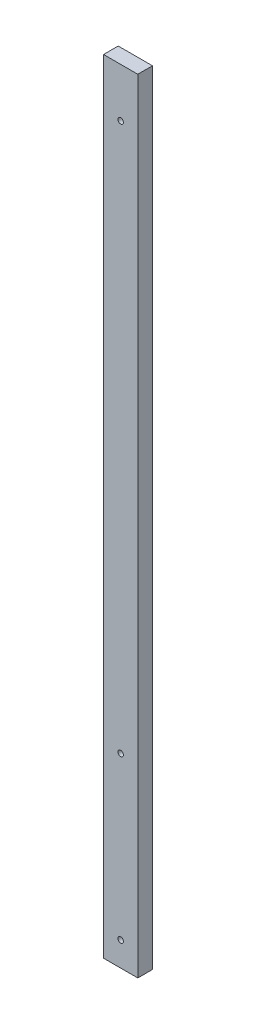
from build123d import *

# Parameters (mm, degrees)
SKETCH1_W               = 88.9
SKETCH1_H               = 38.1
BOSS_EXTRUDE1_DEPTH     = 2032
CUT_EXTRUDE1_DEPTH      = 2033.843184434
CUT_EXTRUDE1_DEPTH_BACK = 2033.843184434
SKETCH2_R               = 7.14375


with BuildPart() as part:
    # Sketch1 → Boss-Extrude1 (new body)
    with BuildSketch(Plane(origin=(0, 0, 0), x_dir=(1, 0, 0), z_dir=(0, 1, 0))):
        Rectangle(SKETCH1_W, SKETCH1_H)
    extrude(amount=BOSS_EXTRUDE1_DEPTH)

    # Sketch2 → Cut-Extrude1 (cut, two sides: drawn at the far end of the back side and taken through both)
    with BuildSketch(Plane.XY.offset(19.05).offset(-CUT_EXTRUDE1_DEPTH_BACK)):
        with Locations((0, 63.5)):
            Circle(SKETCH2_R)
        with Locations((0, 482.6)):
            Circle(SKETCH2_R)
        with Locations((0, 1905)):
            Circle(SKETCH2_R)
    extrude(amount=CUT_EXTRUDE1_DEPTH + CUT_EXTRUDE1_DEPTH_BACK, mode=Mode.SUBTRACT)


solid = part.part
